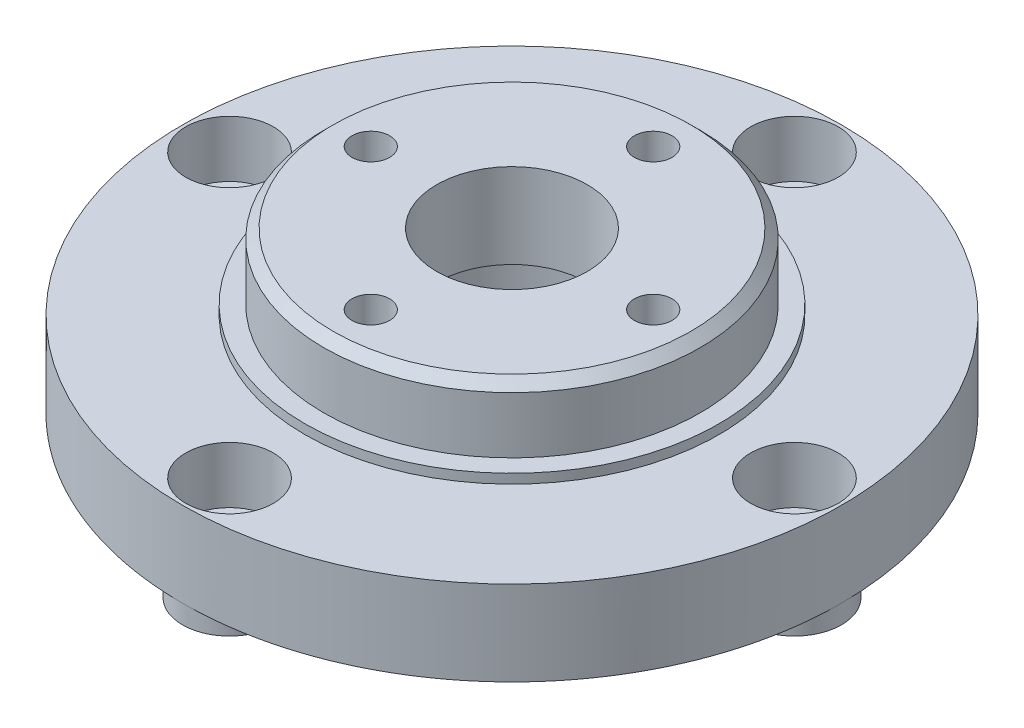
from build123d import *
from build123d.topology import SkipClean

# Parameters (mm, degrees)
SKETCH1_R           = 35
SKETCH1_R_2         = 11.1
SKETCH1_R_3         = 2.65
BOSS_EXTRUDE1_DEPTH = 3
SKETCH2_R           = 35
SKETCH2_R_2         = 4.65
SKETCH2_R_3         = 11.1
BOSS_EXTRUDE2_DEPTH = 6
BOSS_EXTRUDE3_START = -1
SKETCH3_R           = 11.1
SKETCH3_R_2         = 8
BOSS_EXTRUDE3_DEPTH = 1
SKETCH4_R           = 20
SKETCH4_R_2         = 8
BOSS_EXTRUDE4_DEPTH = 8
SKETCH5_R           = 22
SKETCH5_R_2         = 20
BOSS_EXTRUDE5_DEPTH = 1
BOSS_EXTRUDE6_START = 2
SKETCH6_R           = 5
SKETCH6_R_2         = 2.65
BOSS_EXTRUDE6_DEPTH = 2
SKETCH7_R           = 2
CUT_EXTRUDE1_DEPTH  = 54.018864567
CHAMFER1_SIZE       = 1


with BuildPart() as part:
    # Sketch1 → Boss-Extrude1 (new body)
    with BuildSketch(Plane(origin=(0, 0, 0), x_dir=(1, 0, 0), z_dir=(0, 1, 0))):
        Circle(SKETCH1_R)
        Circle(SKETCH1_R_2, mode=Mode.SUBTRACT)
        with Locations((0, 30)):
            Circle(SKETCH1_R_3, mode=Mode.SUBTRACT)
        with Locations((30, 0)):
            Circle(SKETCH1_R_3, mode=Mode.SUBTRACT)
        with Locations((0, -30)):
            Circle(SKETCH1_R_3, mode=Mode.SUBTRACT)
        with Locations((-30, 0)):
            Circle(SKETCH1_R_3, mode=Mode.SUBTRACT)
    extrude(amount=BOSS_EXTRUDE1_DEPTH)

    # Sketch2 → Boss-Extrude2 (add)
    with BuildSketch(Plane(origin=(0, 3, 0), x_dir=(1, 0, 0), z_dir=(0, 1, 0))):
        Circle(SKETCH2_R)
        with Locations((-30, 0)):
            Circle(SKETCH2_R_2, mode=Mode.SUBTRACT)
        with Locations((0, -30)):
            Circle(SKETCH2_R_2, mode=Mode.SUBTRACT)
        Circle(SKETCH2_R_3, mode=Mode.SUBTRACT)
        with Locations((30, 0)):
            Circle(SKETCH2_R_2, mode=Mode.SUBTRACT)
        with Locations((0, 30)):
            Circle(SKETCH2_R_2, mode=Mode.SUBTRACT)
    extrude(amount=BOSS_EXTRUDE2_DEPTH)

    # Sketch3 → Boss-Extrude3 (add)
    with BuildSketch(Plane(origin=(0, 9, 0), x_dir=(1, 0, 0), z_dir=(0, 1, 0)).offset(BOSS_EXTRUDE3_START)):
        Circle(SKETCH3_R)
        Circle(SKETCH3_R_2, mode=Mode.SUBTRACT)
    extrude(amount=BOSS_EXTRUDE3_DEPTH)

    # Sketch4 → Boss-Extrude4 (add)
    with BuildSketch(Plane(origin=(0, 9, 0), x_dir=(1, 0, 0), z_dir=(0, 1, 0))):
        Circle(SKETCH4_R)
        Circle(SKETCH4_R_2, mode=Mode.SUBTRACT)
    extrude(amount=BOSS_EXTRUDE4_DEPTH)

    # Sketch5 → Boss-Extrude5 (add)
    with BuildSketch(Plane(origin=(0, 9, 0), x_dir=(1, 0, 0), z_dir=(0, 1, 0))):
        Circle(SKETCH5_R)
        Circle(SKETCH5_R_2, mode=Mode.SUBTRACT)
    extrude(amount=BOSS_EXTRUDE5_DEPTH)

    # Sketch6 → Boss-Extrude6 (add)
    # profile 1 of 4: a face of its own
    with SkipClean():  # the faces are left unmerged after this step: merging them gives an invalid solid
        with BuildSketch(Plane(origin=(0, 0, 0), x_dir=(-1, 0, 0), z_dir=(0, -1, 0)).offset(BOSS_EXTRUDE6_START)):
            with Locations((30, 0)):
                Circle(SKETCH6_R)
            with Locations((30, 0)):
                Circle(SKETCH6_R_2, mode=Mode.SUBTRACT)
        # profile 2 of 4: a face of its own
        with BuildSketch(Plane(origin=(0, 0, 0), x_dir=(-1, 0, 0), z_dir=(0, -1, 0)).offset(BOSS_EXTRUDE6_START)):
            with Locations((0, -30)):
                Circle(SKETCH6_R)
            with Locations((0, -30)):
                Circle(SKETCH6_R_2, mode=Mode.SUBTRACT)
        # profile 3 of 4: a face of its own
        with BuildSketch(Plane(origin=(0, 0, 0), x_dir=(-1, 0, 0), z_dir=(0, -1, 0)).offset(BOSS_EXTRUDE6_START)):
            with Locations((-30, 0)):
                Circle(SKETCH6_R)
            with Locations((-30, 0)):
                Circle(SKETCH6_R_2, mode=Mode.SUBTRACT)
        # profile 4 of 4: a face of its own
        with BuildSketch(Plane(origin=(0, 0, 0), x_dir=(-1, 0, 0), z_dir=(0, -1, 0)).offset(BOSS_EXTRUDE6_START)):
            with Locations((0, 30)):
                Circle(SKETCH6_R)
            with Locations((0, 30)):
                Circle(SKETCH6_R_2, mode=Mode.SUBTRACT)
        extrude(amount=-BOSS_EXTRUDE6_DEPTH)

    # Sketch7 → Cut-Extrude1 (cut, through all)
    with SkipClean():  # the faces are left unmerged after this step: merging them gives an invalid solid
        with BuildSketch(Plane(origin=(0, 17, 0), x_dir=(1, 0, 0), z_dir=(0, 1, 0))):
            with Locations((0, 15)):
                Circle(SKETCH7_R)
            with Locations((15, 0)):
                Circle(SKETCH7_R)
            with Locations((0, -15)):
                Circle(SKETCH7_R)
            with Locations((-15, 0)):
                Circle(SKETCH7_R)
        extrude(amount=-CUT_EXTRUDE1_DEPTH, mode=Mode.SUBTRACT)

    # Chamfer1
    chamfer1_edges = [part.edges().sort_by_distance(p)[0] for p in [
        (-20, 17, 0),
        (-11.1, 0, 0),
    ]]
    chamfer(chamfer1_edges, length=CHAMFER1_SIZE)


solid = part.part
